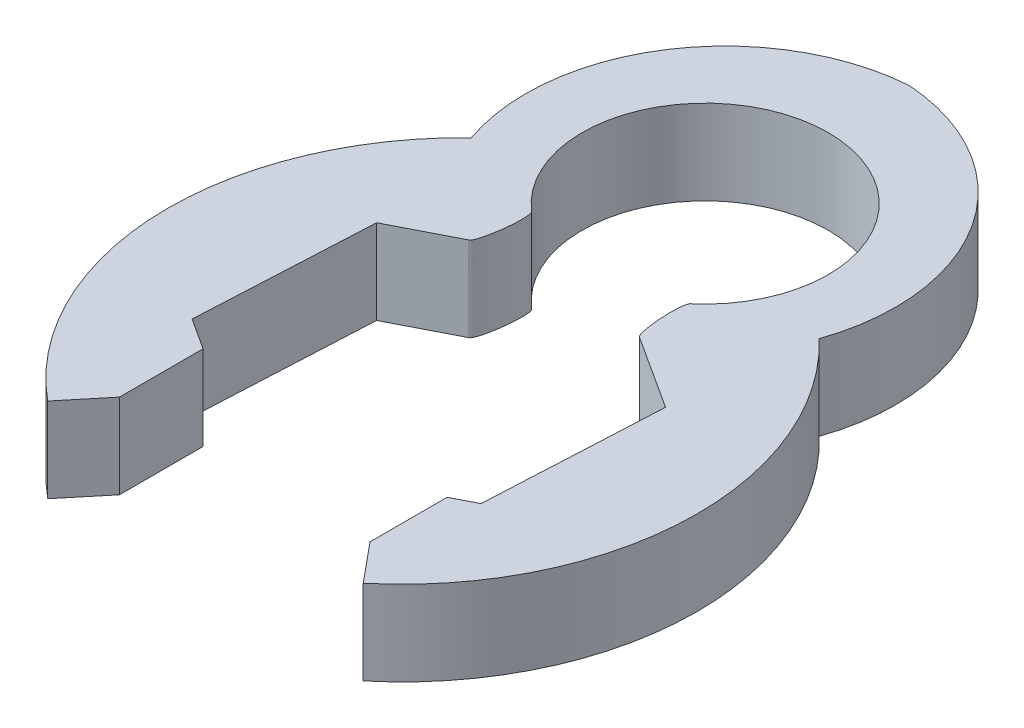
from build123d import *

# Parameters (mm, degrees)
BOSS_EXTRUDE1_DEPTH = 3.175


with BuildPart() as part:
    # Sketch3 → Boss-Extrude1 (new body)
    with BuildSketch(Plane(origin=(0, 0, 0), x_dir=(1, 0, 0), z_dir=(0, 1, 0))):
        with BuildLine():
            Line((-5.541525375, 3.58326618), (-2.47962532, 5.150959008))
            Line((-2.47962532, 5.150959008), (-2.47962532, 6.474170352))
            ThreePointArc((-2.47962532, 6.474170352), (-2.221563685, 14.417025562), (4.617359972, 10.369227654))
            ThreePointArc((4.617359972, 10.369227654), (4.047797908, 8.147663968), (2.47962532, 6.474170352))
            Line((2.47962532, 6.474170352), (2.47962532, 5.20231788))
            Line((2.47962532, 5.20231788), (5.873962228, 3.007468661))
            Line((5.873962228, 3.007468661), (5.541525375, -3.58326618))
            Line((5.541525375, -3.58326618), (4.701204968, -4.013510228))
            Line((4.701204968, -4.013510228), (4.701204968, -6.905610932))
            Line((4.701204968, -6.905610932), (5.918780254, -8.378526195))
            ThreePointArc((5.918780254, -8.378526195), (9.922634137, -0.265088751), (6.526624698, 8.120961152))
            ThreePointArc((6.526624698, 8.120961152), (5.706991897, 14.686716316), (0, 18.035026682))
            ThreePointArc((0, 18.035026682), (-5.706991897, 14.686716316), (-6.526624698, 8.120961152))
            ThreePointArc((-6.526624698, 8.120961152), (-9.922634137, -0.265088751), (-5.918780254, -8.378526195))
            Line((-5.918780254, -8.378526195), (-4.701204968, -6.905610932))
            Line((-4.701204968, -6.905610932), (-4.701204968, -3.765798027))
            Line((-4.701204968, -3.765798027), (-5.873962228, -3.007468661))
            Line((-5.873962228, -3.007468661), (-5.541525375, 3.58326618))
        make_face()
        with BuildLine():
            Line((-2.47962532, 6.474170352), (-2.47962532, 5.150959008))
            Line((-2.47962532, 5.150959008), (-1.063503338, 5.876013463))
            ThreePointArc((-1.063503338, 5.876013463), (-1.79663243, 6.115743784), (-2.47962532, 6.474170352))
        make_face()
        with BuildLine():
            ThreePointArc((2.47962532, 6.474170352), (1.921985685, 6.17089654), (1.328021538, 5.946968965))
            Line((1.328021538, 5.946968965), (2.47962532, 5.20231788))
            Line((2.47962532, 5.20231788), (2.47962532, 6.474170352))
        make_face()
    extrude(amount=BOSS_EXTRUDE1_DEPTH)

    # Fillet6
    # a fillet whose section is not a circle: 1.27 mm, written as the material it takes off along each edge
    with BuildSketch(Plane(origin=(1.328021538, -5.283304691, -5.946968965), x_dir=(0.8397378391322112, 0, 0.5429920455490709), z_dir=(0, 1, 0))) as fillet6_piece_1:
        with BuildLine():
            Bezier((2.113321876, 0), (0.3966534, 0), (0.898889741, 1.641556979), weights=[1, 0.118948346, 1])
            ThreePointArc((0.898889741, 1.641556979), (0.533488386, 0.774757636), (0, 0))
            Line((0, 0), (2.113321876, 0))
        make_face()
    extrude(amount=13.741609382, mode=Mode.SUBTRACT)
    with BuildSketch(Plane(origin=(-1.063503338, -6.120582224, -5.876013463), x_dir=(-0.891835980226881, 0, -0.4523589110128793), z_dir=(0, 1, 0))) as fillet6_piece_2:
        with BuildLine():
            Bezier((2.168149873, 0), (0.323600022, 0.445521101), (1.438773255, 1.980852292), weights=[1, 0.11123936, 1])
            Line((1.438773255, 1.980852292), (0, 0))
            ThreePointArc((0, 0), (1.084074937, 0.129064678), (2.168149873, 0))
        make_face()
    extrude(amount=15.416164449, mode=Mode.SUBTRACT)


solid = part.part
